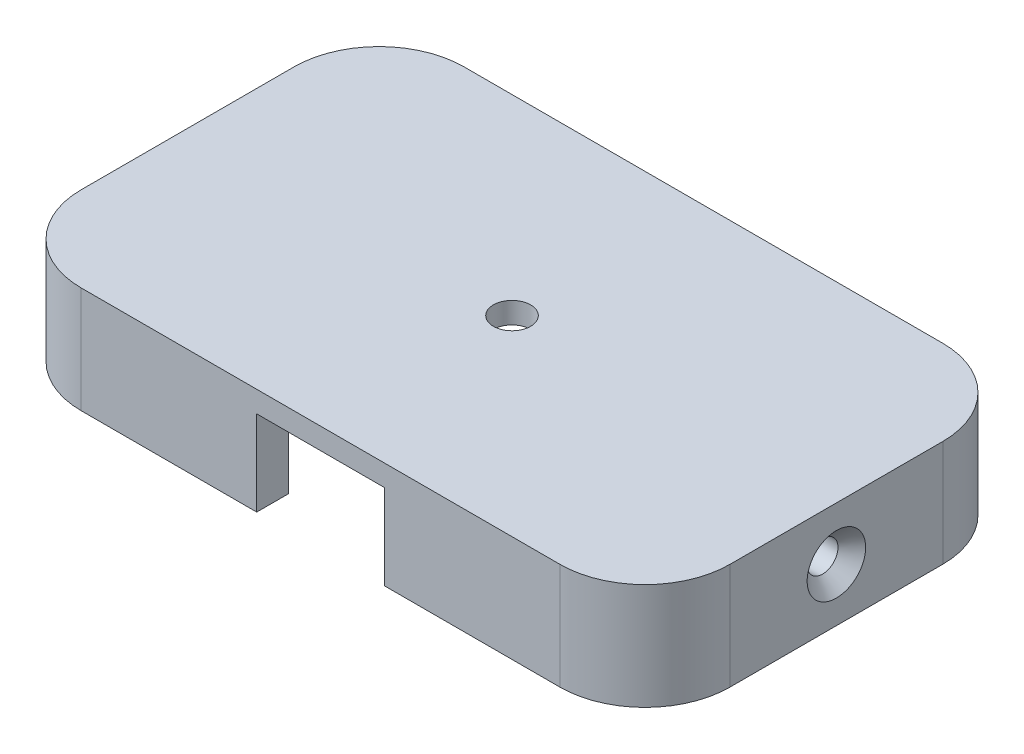
from build123d import *

# Parameters (mm, degrees)
BOSS_EXTRUDE1_DEPTH        = 10
BOSS_EXTRUDE2_DEPTH        = 2
F_3_5_3_5_DIAMETER_HOLE1_D = 3.5
SKETCH8_W                  = 12
SKETCH8_H                  = 8
CUT_EXTRUDE1_DEPTH         = 5


with BuildPart() as part:
    # Sketch1 → Boss-Extrude1 (new body)
    with BuildSketch(Plane(origin=(0, 0, 0), x_dir=(1, 0, 0), z_dir=(0, 1, 0))):
        with BuildLine():
            Line((-22.5, 18), (22.5, 18))
            ThreePointArc((22.5, 18), (28.156854249, 15.656854249), (30.5, 10))
            Line((30.5, 10), (30.5, -10))
            ThreePointArc((30.5, -10), (28.156854249, -15.656854249), (22.5, -18))
            Line((22.5, -18), (-22.5, -18))
            ThreePointArc((-22.5, -18), (-28.156854249, -15.656854249), (-30.5, -10))
            Line((-30.5, -10), (-30.5, 10))
            ThreePointArc((-30.5, 10), (-28.156854249, 15.656854249), (-22.5, 18))
        make_face()
        with BuildLine():
            Line((-22.5, -15), (22.5, -15))
            ThreePointArc((22.5, -15), (26.035533906, -13.535533906), (27.5, -10))
            Line((27.5, -10), (27.5, 10))
            ThreePointArc((27.5, 10), (26.035533906, 13.535533906), (22.5, 15))
            Line((22.5, 15), (-22.5, 15))
            ThreePointArc((-22.5, 15), (-26.035533906, 13.535533906), (-27.5, 10))
            Line((-27.5, 10), (-27.5, -10))
            ThreePointArc((-27.5, -10), (-26.035533906, -13.535533906), (-22.5, -15))
        make_face(mode=Mode.SUBTRACT)
    extrude(amount=-BOSS_EXTRUDE1_DEPTH)

    # Sketch1<2> → Boss-Extrude2 (add)
    with BuildSketch(Plane(origin=(0, 0, 0), x_dir=(1, 0, 0), z_dir=(0, 1, 0))):
        with BuildLine():
            ThreePointArc((-27.5, -10), (-26.035533906, -13.535533906), (-22.5, -15))
            Line((-22.5, -15), (22.5, -15))
            ThreePointArc((22.5, -15), (26.035533906, -13.535533906), (27.5, -10))
            Line((27.5, -10), (27.5, 10))
            ThreePointArc((27.5, 10), (26.035533906, 13.535533906), (22.5, 15))
            Line((22.5, 15), (-22.5, 15))
            ThreePointArc((-22.5, 15), (-26.035533906, 13.535533906), (-27.5, 10))
            Line((-27.5, 10), (-27.5, -10))
        make_face()
    extrude(amount=-BOSS_EXTRUDE2_DEPTH)

    # Sketch4 → CSK for M2.5 Flat Head Machine Screw1 (revolve, cut)
    with BuildSketch(Plane(origin=(30.5, -5, 0), x_dir=(0, 0, -1), z_dir=(0, 1, 0))):
        Polygon((0, 0), (0, 10.871247898), (1.45, 10), (1.45, 1.3), (2.75, 0), align=None)
    csk_for_m2_5_flat_head_machine_screw1 = revolve(axis=Axis((36.85, -5, 0), (-1, 0, 0)), mode=Mode.SUBTRACT)

    # Mirror1: CSK for M2.5 Flat Head Machine Screw1 across plane
    add(csk_for_m2_5_flat_head_machine_screw1.mirror(Plane(origin=(0, 0, 0), x_dir=(0, 0, 1), z_dir=(1, 0, 0))), mode=Mode.SUBTRACT)

    # Ø3.5 (3.5) Diameter Hole1 (through all)
    with Locations(Plane(origin=(0, -2, 0), x_dir=(-1, 0, 0), z_dir=(0, -1, 0))):
        with Locations((0, 0)):
            Hole(F_3_5_3_5_DIAMETER_HOLE1_D / 2)

    # Sketch8 → Cut-Extrude1 (cut)
    with BuildSketch(Plane.XY.offset(18)):
        with Locations((0, -6)):
            Rectangle(SKETCH8_W, SKETCH8_H)
    extrude(amount=-CUT_EXTRUDE1_DEPTH, mode=Mode.SUBTRACT)


solid = part.part
